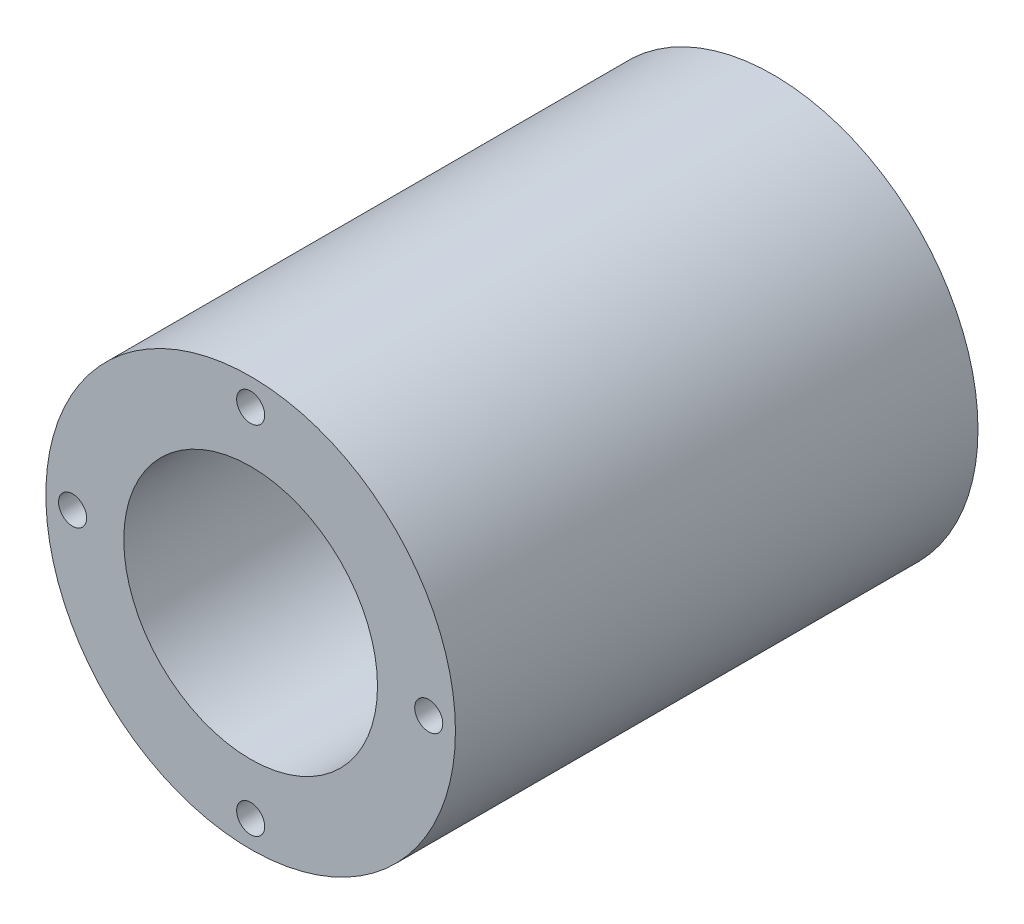
from build123d import *

# Parameters (mm, degrees)
SKETCH1_W              = 93.16400014
SKETCH1_H              = 13.8938
BACKFACEPATTERN_COUNT  = 6
FRONTFACEPATTERN_COUNT = 4


with BuildPart() as part:
    # Sketch1 → Revolve1 (revolve)
    with BuildSketch(Plane(origin=(0, 0, 0), x_dir=(0, 0, -1), z_dir=(1, 0, 0))):
        with Locations((-72.887000006, 29.5656)):
            Rectangle(SKETCH1_W, SKETCH1_H)
    revolve(axis=Axis((0, 0, 119.469000076), (0, 0, -1)))

    # Sketch9 → M6x1.0 Tapped Hole3 (revolve, cut)
    with BuildSketch(Plane(origin=(0, 30.565600032, 26.304999936), x_dir=(0, 1, 0), z_dir=(1, 0, 0))):
        Polygon((0, 0), (0, 16.502151548), (2.5, 15), (2.5, 0), align=None)
    m6x1_0_tapped_hole3 = revolve(axis=Axis((0, 30.565600032, 19.954999936), (0, 0, 1)), mode=Mode.SUBTRACT)

    # BackFacePattern: M6x1.0 Tapped Hole3 ×6 about axis
    backfacepattern_axis = Axis((0, 0, 1000), (0, 0, -1))
    for i in range(1, BACKFACEPATTERN_COUNT):
        add(m6x1_0_tapped_hole3.rotate(backfacepattern_axis, i * 360 / BACKFACEPATTERN_COUNT), mode=Mode.SUBTRACT)

    # Sketch6 → M6x1.0 Tapped Hole2 (revolve, cut)
    with BuildSketch(Plane(origin=(0, 31.75, 119.469000076), x_dir=(0, -1, 0), z_dir=(1, 0, 0))):
        Polygon((0, 0), (0, 16.502151548), (2.5, 15), (2.5, 0), align=None)
    m6x1_0_tapped_hole2 = revolve(axis=Axis((0, 31.75, 125.819000076), (0, 0, -1)), mode=Mode.SUBTRACT)

    # FrontFacePattern: M6x1.0 Tapped Hole2 ×4 about axis
    frontfacepattern_axis = Axis((0, 0, 1000), (0, 0, -1))
    for i in range(1, FRONTFACEPATTERN_COUNT):
        add(m6x1_0_tapped_hole2.rotate(frontfacepattern_axis, i * 360 / FRONTFACEPATTERN_COUNT), mode=Mode.SUBTRACT)


solid = part.part
